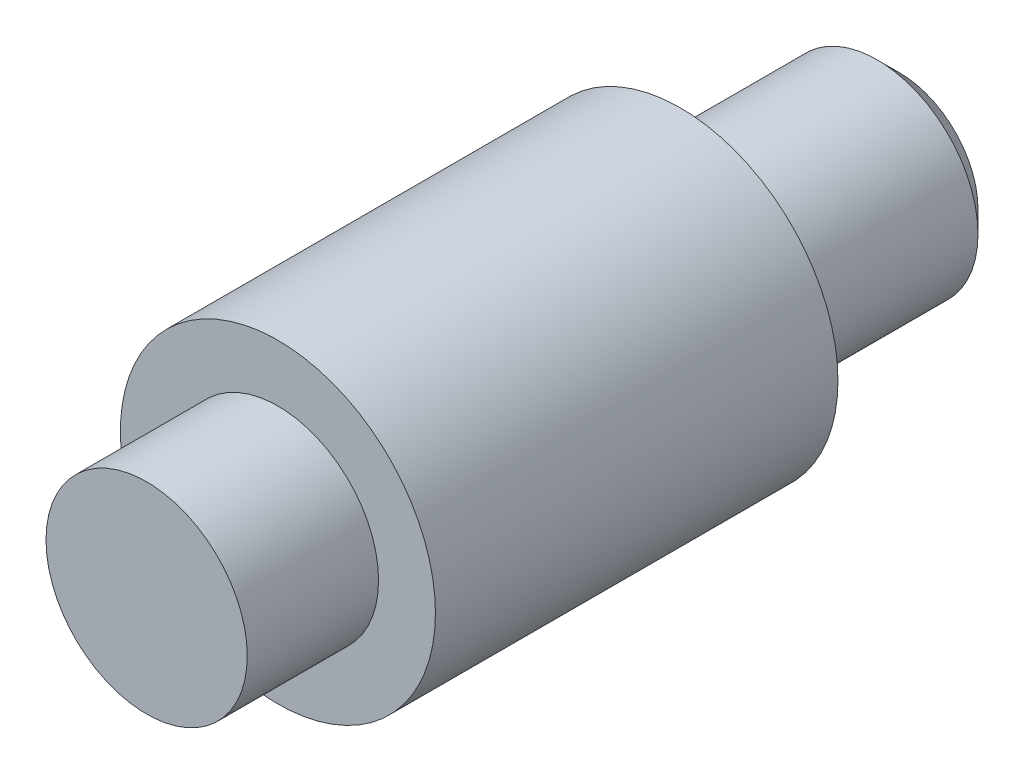
from build123d import *

# Parameters (mm, degrees)
SKETCH3_R           = 3.6
BOSS_EXTRUDE1_DEPTH = 9.2
SKETCH4_R           = 2.3
BOSS_EXTRUDE2_DEPTH = 5
BOSS_EXTRUDE3_START = 3
SKETCH5_R           = 2.3
BOSS_EXTRUDE3_DEPTH = 3
CHAMFER1_SIZE       = 0.5


with BuildPart() as part:
    # Sketch3 → Boss-Extrude1 (new body)
    with BuildSketch(Plane.XY):
        Circle(SKETCH3_R)
    extrude(amount=BOSS_EXTRUDE1_DEPTH)

    # Sketch4 → Boss-Extrude2 (add)
    with BuildSketch(Plane.XY):
        Circle(SKETCH4_R)
    extrude(amount=-BOSS_EXTRUDE2_DEPTH)

    # Sketch5 → Boss-Extrude3 (add)
    with BuildSketch(Plane.XY.offset(9.2).offset(BOSS_EXTRUDE3_START)):
        Circle(SKETCH5_R)
    extrude(amount=-BOSS_EXTRUDE3_DEPTH)

    # Chamfer1
    chamfer1_edges = [part.edges().sort_by_distance(p)[0] for p in [
        (-2.3, 0, -5),
    ]]
    chamfer(chamfer1_edges, length=CHAMFER1_SIZE)


solid = part.part
